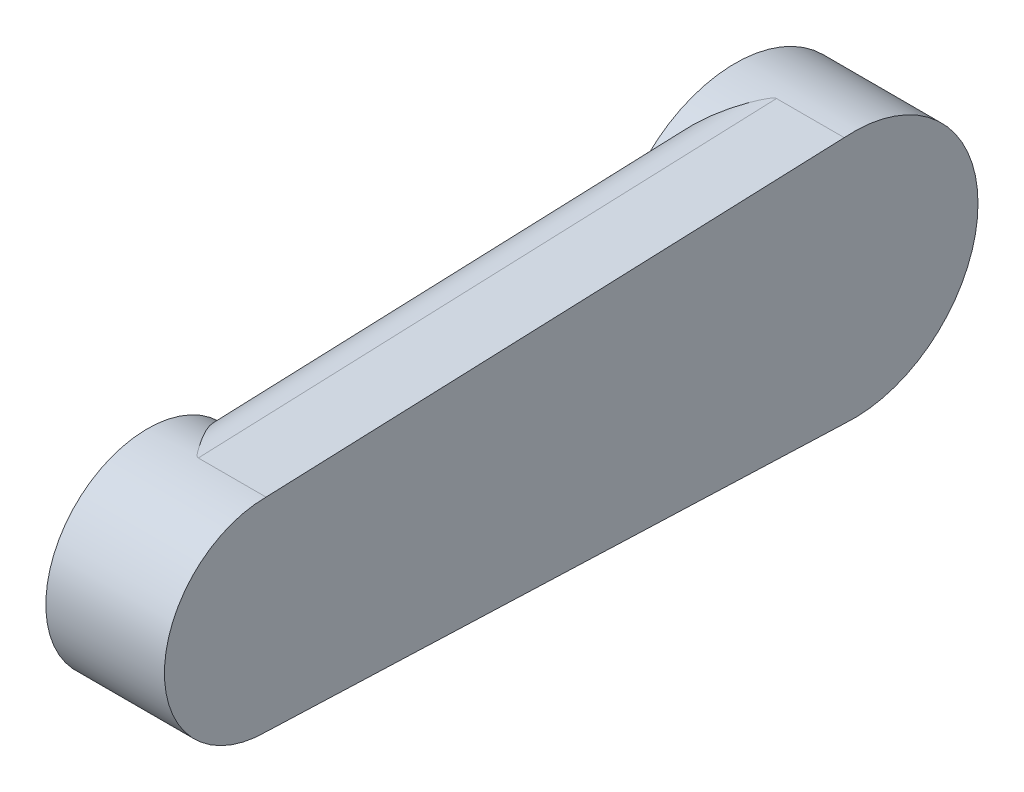
from build123d import *

# Parameters (mm, degrees)
BOSS_EXTRUDE11_DEPTH = 1050
FILLET3_R            = 450
FILLET4_R            = 450
SKETCH14_R           = 500
SKETCH14_R_2         = 300
BOSS_EXTRUDE12_DEPTH = 141


with BuildPart() as part:
    # Sketch13 → Boss-Extrude11 (new body)
    with BuildSketch(Plane(origin=(0, 0, 0), x_dir=(0, 0, -1), z_dir=(1, 0, 0))):
        with BuildLine():
            Line((-5203.97578109, 900), (-84.426039545, 1096.755325424))
            ThreePointArc((-84.426039545, 1096.755325424), (1100, 0), (-84.426039545, -1096.755325424))
            Line((-84.426039545, -1096.755325424), (-5203.97578109, -900))
            ThreePointArc((-5203.97578109, -900), (-6103.97578109, 0), (-5203.97578109, 900))
        make_face()
    extrude(amount=-BOSS_EXTRUDE11_DEPTH)

    # Fillet3
    # the kernel refuses this fillet: 450 mm, written as the material it takes off along each edge
    with BuildSketch(Plane(origin=(-1050, 856.795721699, 6328.145870684), x_dir=(1, 0, 0), z_dir=(0, 0.038403802934356995, -0.9992623018608172))) as fillet3_piece_1_section:
        with BuildLine():
            CenterArc((FILLET3_R, FILLET3_R), FILLET3_R, 180, 90)
            Line((0, FILLET3_R), (-FILLET3_R * 0.02, FILLET3_R))
            Line((-FILLET3_R * 0.02, FILLET3_R), (-FILLET3_R * 0.02, -FILLET3_R * 0.02))
            Line((-FILLET3_R * 0.02, -FILLET3_R * 0.02), (FILLET3_R, -FILLET3_R * 0.02))
            Line((FILLET3_R, -FILLET3_R * 0.02), (FILLET3_R, 0))
        make_face()
    fillet3_piece_1 = extrude(amount=7373.329211972, mode=Mode.PRIVATE)
    fillet3_piece_1 = fillet3_piece_1 - Plane(origin=(-939.154222866, 0, 5203.97578109), x_dir=(0, -1, 0), z_dir=(1, 0, 0)) * Cylinder(900, 16547, mode=Mode.PRIVATE)
    fillet3_piece_1 = fillet3_piece_1 - Plane(origin=(-939.154222866, 0, 0), x_dir=(0, 0.9970502958403585, 0.07675094504078517), z_dir=(1, 0, 0)) * Cylinder(1100, 16547, mode=Mode.PRIVATE)
    add(fillet3_piece_1, mode=Mode.SUBTRACT)

    # Fillet4
    # the kernel refuses this fillet: 450 mm, written as the material it takes off along each edge
    with BuildSketch(Plane(origin=(-1050, -1139.959603726, -1039.744050049), x_dir=(1, 0, 0), z_dir=(0, 0.038403802934357, 0.9992623018608173))) as fillet4_piece_1_section:
        with BuildLine():
            CenterArc((FILLET4_R, FILLET4_R), FILLET4_R, 180, 90)
            Line((0, FILLET4_R), (-FILLET4_R * 0.02, FILLET4_R))
            Line((-FILLET4_R * 0.02, FILLET4_R), (-FILLET4_R * 0.02, -FILLET4_R * 0.02))
            Line((-FILLET4_R * 0.02, -FILLET4_R * 0.02), (FILLET4_R, -FILLET4_R * 0.02))
            Line((FILLET4_R, -FILLET4_R * 0.02), (FILLET4_R, 0))
        make_face()
    fillet4_piece_1 = extrude(amount=7373.329211972, mode=Mode.PRIVATE)
    fillet4_piece_1 = fillet4_piece_1 - Plane(origin=(-939.14440513, 0, 0), x_dir=(0, 0.9970502958403585, 0.07675094504078517), z_dir=(1, 0, 0)) * Cylinder(1100, 16547, mode=Mode.PRIVATE)
    fillet4_piece_1 = fillet4_piece_1 - Plane(origin=(-939.14440513, 0, 5203.97578109), x_dir=(0, -1, 0), z_dir=(1, 0, 0)) * Cylinder(900, 16547, mode=Mode.PRIVATE)
    add(fillet4_piece_1, mode=Mode.SUBTRACT)

    # Sketch14 → Boss-Extrude12 (add)
    # profile 1 of 2: a face of its own
    with BuildSketch(Plane.ZY.offset(1050)):
        with Locations(Location((0, 0, 0), (0, 0, 180))):
            Circle(SKETCH14_R)
        Polygon((-96.738028444, 96.277150217), (-96.738028444, 358.567374068), (96.738028444, 358.567374068), (96.738028444, 96.277150217), (356.859091418, 96.277150217), (356.859091418, -96.277150217), (96.738028444, -96.277150217), (96.738028444, -358.567374068), (-96.738028444, -358.567374068), (-96.738028444, -96.277150217), (-356.859091418, -96.277150217), (-356.859091418, 96.277150217), align=None, mode=Mode.SUBTRACT)
    # profile 2 of 2: a face of its own
    with BuildSketch(Plane.ZY.offset(1050)):
        with Locations(Location((5203.97578109, 0, 0), (0, 0, 180))):
            Circle(SKETCH14_R_2)
        Polygon((5264.6356884, 55.836406433), (5403.316008511, 55.836406433), (5403.316008511, -55.836406433), (5264.6356884, -55.836406433), (5264.6356884, -216.560493249), (5143.315873781, -216.560493249), (5143.315873781, -55.836406433), (5004.63555367, -55.836406433), (5004.63555367, 55.836406433), (5143.315873781, 55.836406433), (5143.315873781, 216.560493249), (5264.6356884, 216.560493249), align=None, mode=Mode.SUBTRACT)
    extrude(amount=BOSS_EXTRUDE12_DEPTH)


solid = part.part
